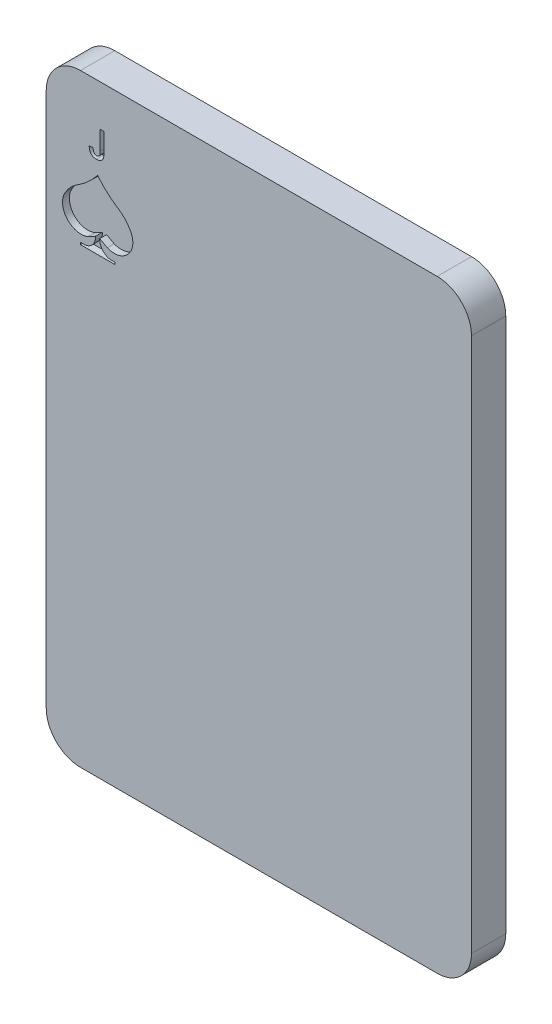
from build123d import *

# Parameters (mm, degrees)
EXTRUDE_1_DEPTH     = 5
CUT_EXTRUDE_START   = -1
CUT_EXTRUDE_3_DEPTH = 1


# Read off the part's stored shape, not the designer's step: Вырез-Вытянуть3
with BuildPart() as part:
    # Эскиз1 → Бобышка-Вытянуть1 (new body)
    with BuildSketch(Plane.XY):
        with BuildLine():
            Line((5, 0), (57, 0))
            ThreePointArc((57, 0), (60.535533906, 1.464466094), (62, 5))
            Line((62, 5), (62, 83))
            ThreePointArc((62, 83), (60.535533906, 86.535533906), (57, 88))
            Line((57, 88), (5, 88))
            ThreePointArc((5, 88), (1.464466094, 86.535533906), (0, 83))
            Line((0, 83), (0, 5))
            ThreePointArc((0, 5), (1.464466094, 1.464466094), (5, 0))
        make_face()
    extrude(amount=EXTRUDE_1_DEPTH)

    # Вырез-Вытянуть3 outline → Вырез-Вытянуть3 (cut)
    with BuildSketch(Plane.XY.offset(5).offset(CUT_EXTRUDE_START)):
        with BuildLine():
            add(Edge.make_bspline(
                [(7.322115385, 77.948717949), (7.280403728, 77.949629189), (7.199154126, 77.951404182), (7.08103096, 77.965514138), (6.970032623, 77.986734715), (6.86753928, 78.020868189), (6.771471542, 78.06080497), (6.683688955, 78.112132534), (6.602688938, 78.171353702), (6.530522286, 78.24100741), (6.465447665, 78.318830964), (6.41163812, 78.407249412), (6.364084469, 78.503063707), (6.328183734, 78.608942585), (6.298735587, 78.722922407), (6.2805208, 78.846457423), (6.268556671, 78.978392008), (6.269001965, 79.069415592), (6.269230769, 79.116185897)],
                knots=[0, 0, 0, 0, 0.069384338, 0.135152862, 0.197735709, 0.257048427, 0.31458961, 0.370543528, 0.425833354, 0.481158895, 0.537040397, 0.594138756, 0.652974992, 0.714682156, 0.779789612, 0.848620873, 0.922217432, 1, 1, 1, 1], degree=3))
            add(Edge.make_bspline(
                [(8.423076923, 79.28525641), (8.422846482, 79.24465196), (8.422400519, 79.16607163), (8.416777036, 79.051655992), (8.406996568, 78.94425203), (8.394710578, 78.843624109), (8.377857705, 78.749984901), (8.357009271, 78.663646779), (8.333382771, 78.583908695), (8.296299771, 78.48874028), (8.239839042, 78.380770097), (8.153444079, 78.266259522), (8.049022592, 78.168573661), (7.9277584, 78.088174586), (7.79256156, 78.026127128), (7.645762848, 77.981077752), (7.487701683, 77.953199535), (7.378323021, 77.950239206), (7.322115385, 77.948717949)],
                knots=[0, 0, 0, 0, 0.061211027, 0.118459496, 0.172633106, 0.223776859, 0.271245742, 0.315976481, 0.35763086, 0.396515037, 0.469825178, 0.540534635, 0.611753614, 0.684345849, 0.758929938, 0.835221686, 0.915323526, 1, 1, 1, 1], degree=3))
            Line((8.423076923, 79.28525641), (8.423076923, 82))
            Line((8.423076923, 82), (7.858974359, 82))
            Line((7.858974359, 82), (7.858974359, 79.249198718))
            add(Edge.make_bspline(
                [(7.345352564, 78.41025641), (7.372975773, 78.411180822), (7.4269515, 78.412987123), (7.504373326, 78.431551652), (7.576511792, 78.459404941), (7.641326576, 78.500074876), (7.699113429, 78.549562242), (7.748268345, 78.607960428), (7.785711282, 78.675450105), (7.809293621, 78.737761499), (7.823759213, 78.793221645), (7.83322618, 78.841401042), (7.841207325, 78.895150355), (7.847235632, 78.954806458), (7.853355796, 79.020196267), (7.855800765, 79.091605618), (7.858650581, 79.16851443), (7.858863947, 79.221684424), (7.858974359, 79.249198718)],
                knots=[0, 0, 0, 0, 0.073594239, 0.143803085, 0.211314618, 0.27917152, 0.346904743, 0.413716382, 0.481711687, 0.551880712, 0.590958341, 0.634577158, 0.682868024, 0.735927242, 0.794594596, 0.858103432, 0.926571669, 1, 1, 1, 1], degree=3))
            add(Edge.make_bspline(
                [(6.833333333, 79.179487179), (6.834857441, 79.143941678), (6.83777302, 79.075944064), (6.84743928, 78.978324165), (6.860933127, 78.889536466), (6.877643129, 78.809256715), (6.897109916, 78.737429188), (6.921534218, 78.674633381), (6.947839007, 78.619549931), (6.980181111, 78.573892339), (7.014857408, 78.53487098), (7.053004363, 78.501738163), (7.094129871, 78.473504515), (7.138151962, 78.450181335), (7.185565934, 78.432291412), (7.235878922, 78.419864447), (7.289505669, 78.411261561), (7.326352813, 78.410598374), (7.345352564, 78.41025641)],
                knots=[0, 0, 0, 0, 0.102038713, 0.195197389, 0.281231404, 0.35951733, 0.430343554, 0.494370791, 0.552618194, 0.604901828, 0.654275293, 0.702059837, 0.749449665, 0.797086574, 0.844612455, 0.894412072, 0.945554958, 1, 1, 1, 1], degree=3))
            Line((6.833333333, 79.179487179), (6.269230769, 79.116185897))
        make_face()
        with BuildLine():
            ThreePointArc((10.5, 73.3), (8.885670907, 74.522967675), (7.5, 76))
            ThreePointArc((7.5, 76), (6.114329093, 74.522967675), (4.5, 73.3))
            ThreePointArc((4.5, 73.3), (3.605830756, 72.578400365), (2.9, 71.67173195))
            ThreePointArc((2.9, 71.67173195), (2.944094794, 68.407366911), (6.1, 67.57173195))
            Line((6.1, 67.57173195), (7.2, 68.17173195))
            ThreePointArc((7.2, 68.17173195), (6.807193425, 66.949612307), (5.7, 66.3))
            Line((5.7, 66.3), (5, 66.3))
            Line((5, 66.3), (5, 66))
            Line((5, 66), (10, 66))
            Line((10, 66), (10, 66.3))
            Line((10, 66.3), (9.3, 66.3))
            ThreePointArc((9.3, 66.3), (8.192806575, 66.949612307), (7.8, 68.17173195))
            Line((7.8, 68.17173195), (8.9, 67.57173195))
            ThreePointArc((8.9, 67.57173195), (12.055905206, 68.407366911), (12.1, 71.67173195))
            ThreePointArc((12.1, 71.67173195), (11.394169244, 72.578400365), (10.5, 73.3))
        make_face()
    extrude(amount=CUT_EXTRUDE_3_DEPTH, mode=Mode.SUBTRACT)


solid = part.part
